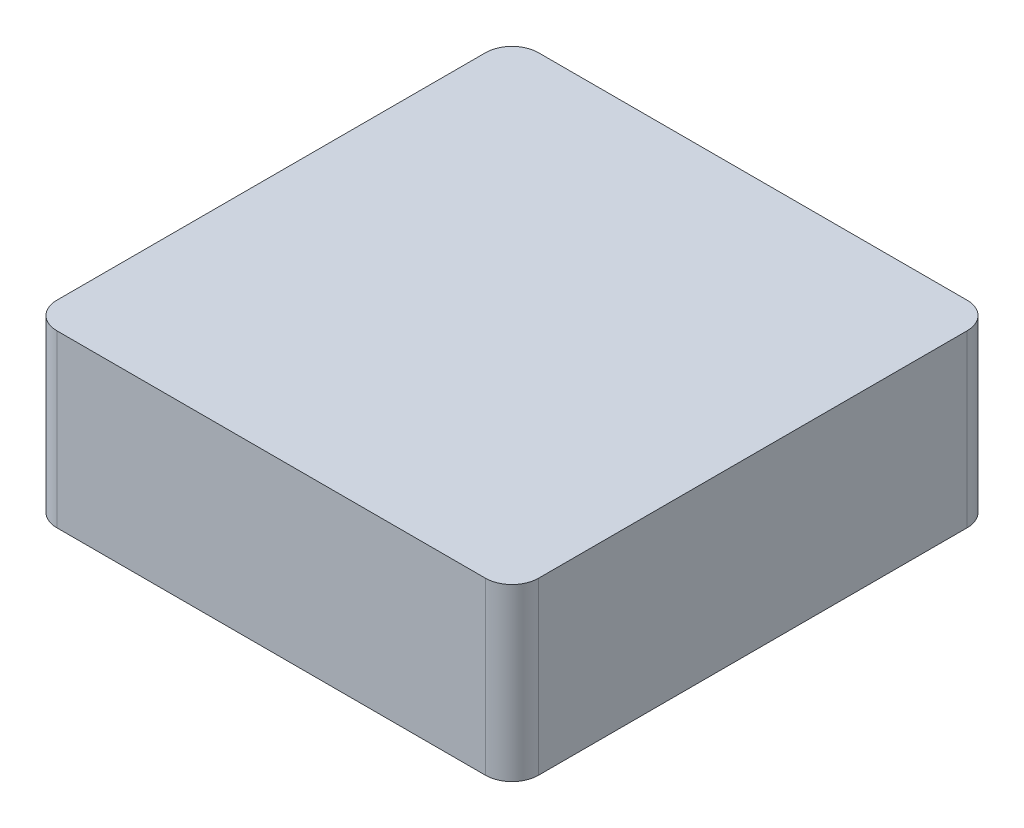
from build123d import *

# Parameters (mm, degrees)
SKETCH1_W           = 127
SKETCH1_H           = 127
BOSS_EXTRUDE1_DEPTH = 45
FILLET1_R           = 7


with BuildPart() as part:
    # Sketch1 → Boss-Extrude1 (new body)
    with BuildSketch(Plane(origin=(0, 0, 0), x_dir=(1, 0, 0), z_dir=(0, 1, 0))):
        with Locations((63.5, 63.5)):
            Rectangle(SKETCH1_W, SKETCH1_H)
    extrude(amount=BOSS_EXTRUDE1_DEPTH)

    # Fillet1
    fillet1_edges = [part.edges().sort_by_distance(p)[0] for p in [
        (127, 22.5, -127),
        (0, 22.5, -127),
        (127, 22.5, 0),
        (0, 22.5, 0),
    ]]
    fillet(fillet1_edges, radius=FILLET1_R)


solid = part.part
